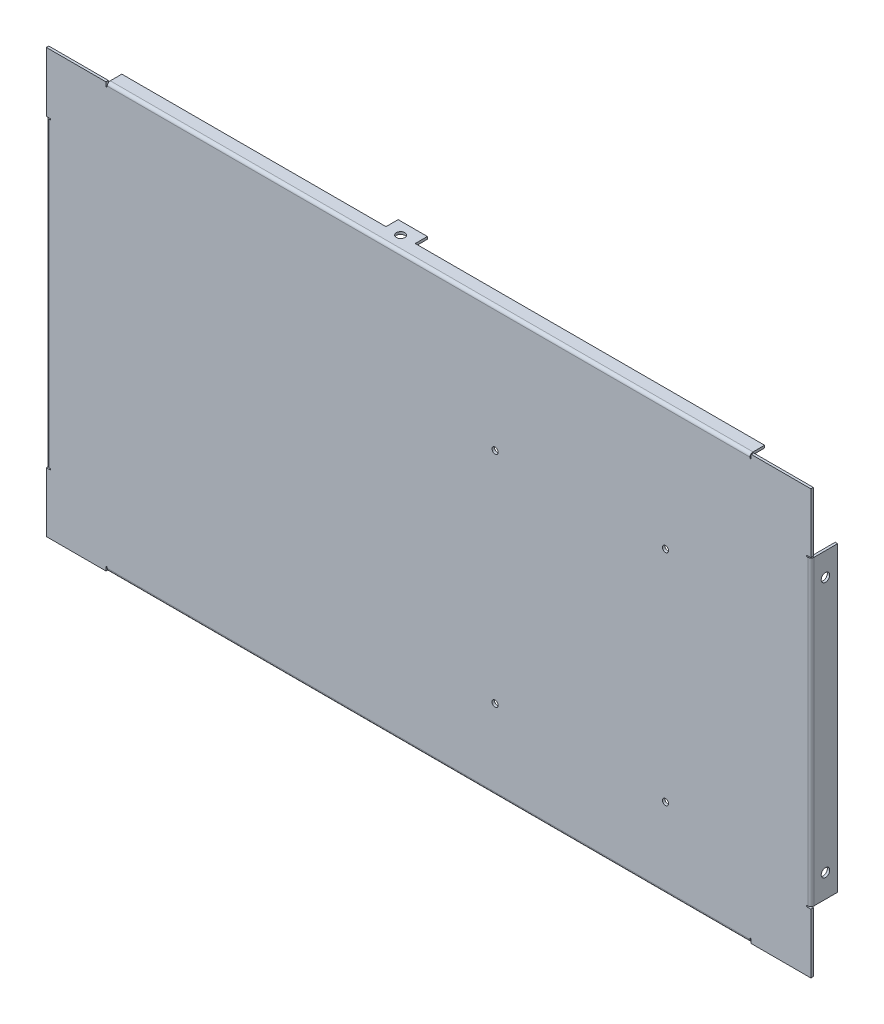
from build123d import *

# Parameters (mm, degrees)
SKETCH_1_W                        = 628
SKETCH_1_H                        = 348
SM_BASE_FLANGE_1_DEPTH            = 2
SM_EDGE_FLANGE_1_STRIP_W          = 9
SM_EDGE_FLANGE_1_STRIP_H          = 2
SM_EDGE_FLANGE_1_STRIP_CUT_DEPTH  = 248
SM_EDGE_FLANGE_1_RELIEF_W         = 10
SM_EDGE_FLANGE_1_RELIEF_H         = 1
SM_EDGE_FLANGE_1_RELIEF_CUT_DEPTH = 2
SM_EDGE_FLANGE_1_DEPTH            = 248
SM_EDGE_FLANGE_2_STRIP_W          = 9
SM_EDGE_FLANGE_2_STRIP_H          = 2
SM_EDGE_FLANGE_2_STRIP_CUT_DEPTH  = 528
SM_EDGE_FLANGE_2_RELIEF_W         = 10
SM_EDGE_FLANGE_2_RELIEF_H         = 1
SM_EDGE_FLANGE_2_RELIEF_CUT_DEPTH = 2
SM_EDGE_FLANGE_2_DEPTH            = 528
SM_EDGE_FLANGE_2_FLAT_DEPTH       = 2
SM_EDGE_FLANGE_3_STRIP_W          = 9
SM_EDGE_FLANGE_3_STRIP_H          = 2
SM_EDGE_FLANGE_3_STRIP_CUT_DEPTH  = 248
SM_EDGE_FLANGE_3_RELIEF_W         = 10
SM_EDGE_FLANGE_3_RELIEF_H         = 1
SM_EDGE_FLANGE_3_RELIEF_CUT_DEPTH = 2
SM_EDGE_FLANGE_3_DEPTH            = 248
SM_EDGE_FLANGE_4_STRIP_W          = 9
SM_EDGE_FLANGE_4_STRIP_H          = 2
SM_EDGE_FLANGE_4_STRIP_CUT_DEPTH  = 528
SM_EDGE_FLANGE_4_RELIEF_W         = 10
SM_EDGE_FLANGE_4_RELIEF_H         = 1
SM_EDGE_FLANGE_4_RELIEF_CUT_DEPTH = 2
SM_EDGE_FLANGE_4_DEPTH            = 528
SKETCH_15_R                       = 3.5
CUT_EXTRUDE_1_DEPTH               = 653.030674125
CUT_EXTRUDE_2_REACH               = 469.756
SKETCH_16_R                       = 3.5
HOLE_WIZARD_M6_1_D                = 5
HOLE_WIZARD_M6_1_DEPTH            = 15
HOLE_WIZARD_M6_1_TIP              = 1.502151548
CUT_EXTRUDE_3_REACH               = 471.238
SKETCH_20_R                       = 3.5


# Sheet-metal steps are written as plain solids
with BuildPart() as part:
    # Sketch 1 → 基体-法兰1 (new body)
    with BuildSketch(Plane.XY):
        Rectangle(SKETCH_1_W, SKETCH_1_H)
    extrude(amount=-SM_BASE_FLANGE_1_DEPTH)

    # 边线-法兰1 strip (across the edge) → 边线-法兰1 strip cut (cut)
    with BuildSketch(Plane(origin=(314, 124, -2), x_dir=(-1, 0, 0), z_dir=(0, -1, 0))):
        with Locations((-2, -1)):
            Rectangle(SM_EDGE_FLANGE_1_STRIP_W, SM_EDGE_FLANGE_1_STRIP_H)
    extrude(amount=SM_EDGE_FLANGE_1_STRIP_CUT_DEPTH, mode=Mode.SUBTRACT)

    # 边线-法兰1 relief (on the sheet) → 边线-法兰1 relief cut (cut)
    with BuildSketch(Plane(origin=(311.5, 124, -2), x_dir=(-1, 0, 0), z_dir=(0, 0, -1))):
        with Locations((-4, 0.5)):
            Rectangle(SM_EDGE_FLANGE_1_RELIEF_W, SM_EDGE_FLANGE_1_RELIEF_H)
        with Locations((-4, -248.5)):
            Rectangle(SM_EDGE_FLANGE_1_RELIEF_W, SM_EDGE_FLANGE_1_RELIEF_H)
    extrude(amount=-SM_EDGE_FLANGE_1_RELIEF_CUT_DEPTH, mode=Mode.SUBTRACT)

    # 边线-法兰1 section (across the edge) → 边线-法兰1 (add)
    with BuildSketch(Plane(origin=(314, 124, -2), x_dir=(-1, 0, 0), z_dir=(0, -1, 0))):
        with BuildLine():
            Line((0, 0.5), (0, 20))
            Line((0, 20), (2, 20))
            Line((2, 20), (2, 0.5))
            ThreePointArc((2, 0.5), (2.146446609, 0.146446609), (2.5, 0))
            Line((2.5, 0), (2.5, -2))
            ThreePointArc((2.5, -2), (0.732233047, -1.267766953), (0, 0.5))
        make_face()
    extrude(amount=SM_EDGE_FLANGE_1_DEPTH)

    # 边线-法兰2 strip (across the edge) → 边线-法兰2 strip cut (cut)
    with BuildSketch(Plane(origin=(-264, 174, -2), x_dir=(0, -1, 0), z_dir=(1, 0, 0))):
        with Locations((-2, -1)):
            Rectangle(SM_EDGE_FLANGE_2_STRIP_W, SM_EDGE_FLANGE_2_STRIP_H)
    extrude(amount=SM_EDGE_FLANGE_2_STRIP_CUT_DEPTH, mode=Mode.SUBTRACT)

    # 边线-法兰2 relief (on the sheet) → 边线-法兰2 relief cut (cut)
    with BuildSketch(Plane(origin=(-264, 171.5, -2), x_dir=(0, -1, 0), z_dir=(0, 0, -1))):
        with Locations((-4, 0.5)):
            Rectangle(SM_EDGE_FLANGE_2_RELIEF_W, SM_EDGE_FLANGE_2_RELIEF_H)
        with Locations((-4, -528.5)):
            Rectangle(SM_EDGE_FLANGE_2_RELIEF_W, SM_EDGE_FLANGE_2_RELIEF_H)
    extrude(amount=-SM_EDGE_FLANGE_2_RELIEF_CUT_DEPTH, mode=Mode.SUBTRACT)

    # 边线-法兰2 bend section (across the edge) → 边线-法兰2 (add)
    with BuildSketch(Plane(origin=(-264, 174, -2), x_dir=(0, -1, 0), z_dir=(1, 0, 0))):
        with BuildLine():
            Line((0, 0.5), (2, 0.5))
            ThreePointArc((2, 0.5), (2.146446609, 0.146446609), (2.5, 0))
            Line((2.5, 0), (2.5, -2))
            ThreePointArc((2.5, -2), (0.732233047, -1.267766953), (0, 0.5))
        make_face()
    extrude(amount=SM_EDGE_FLANGE_2_DEPTH)

    # 边线-法兰2 profile (on flange) → 边线-法兰2 flat (add)
    with BuildSketch(Plane(origin=(0, 174, -2), x_dir=(1, 0, 0), z_dir=(0, 1, 0))):
        Polygon((264, 0.5), (264, 10), (-23, 10), (-23, 20), (-47, 20), (-47, 10), (-264, 10), (-264, 0.5), align=None)
    extrude(amount=-SM_EDGE_FLANGE_2_FLAT_DEPTH)

    # 边线-法兰3 strip (across the edge) → 边线-法兰3 strip cut (cut)
    with BuildSketch(Plane(origin=(-314, -124, -2), x_dir=(1, 0, 0), z_dir=(0, 1, 0))):
        with Locations((-2, -1)):
            Rectangle(SM_EDGE_FLANGE_3_STRIP_W, SM_EDGE_FLANGE_3_STRIP_H)
    extrude(amount=SM_EDGE_FLANGE_3_STRIP_CUT_DEPTH, mode=Mode.SUBTRACT)

    # 边线-法兰3 relief (on the sheet) → 边线-法兰3 relief cut (cut)
    with BuildSketch(Plane(origin=(-311.5, -124, -2), x_dir=(1, 0, 0), z_dir=(0, 0, -1))):
        with Locations((-4, 0.5)):
            Rectangle(SM_EDGE_FLANGE_3_RELIEF_W, SM_EDGE_FLANGE_3_RELIEF_H)
        with Locations((-4, -248.5)):
            Rectangle(SM_EDGE_FLANGE_3_RELIEF_W, SM_EDGE_FLANGE_3_RELIEF_H)
    extrude(amount=-SM_EDGE_FLANGE_3_RELIEF_CUT_DEPTH, mode=Mode.SUBTRACT)

    # 边线-法兰3 section (across the edge) → 边线-法兰3 (add)
    with BuildSketch(Plane(origin=(-314, -124, -2), x_dir=(1, 0, 0), z_dir=(0, 1, 0))):
        with BuildLine():
            Line((0, 0.5), (0, 20))
            Line((0, 20), (2, 20))
            Line((2, 20), (2, 0.5))
            ThreePointArc((2, 0.5), (2.146446609, 0.146446609), (2.5, 0))
            Line((2.5, 0), (2.5, -2))
            ThreePointArc((2.5, -2), (0.732233047, -1.267766953), (0, 0.5))
        make_face()
    extrude(amount=SM_EDGE_FLANGE_3_DEPTH)

    # 边线-法兰4 strip (across the edge) → 边线-法兰4 strip cut (cut)
    with BuildSketch(Plane(origin=(264, -174, -2), x_dir=(0, 1, 0), z_dir=(-1, 0, 0))):
        with Locations((-2, -1)):
            Rectangle(SM_EDGE_FLANGE_4_STRIP_W, SM_EDGE_FLANGE_4_STRIP_H)
    extrude(amount=SM_EDGE_FLANGE_4_STRIP_CUT_DEPTH, mode=Mode.SUBTRACT)

    # 边线-法兰4 relief (on the sheet) → 边线-法兰4 relief cut (cut)
    with BuildSketch(Plane(origin=(264, -171.5, -2), x_dir=(0, 1, 0), z_dir=(0, 0, -1))):
        with Locations((-4, 0.5)):
            Rectangle(SM_EDGE_FLANGE_4_RELIEF_W, SM_EDGE_FLANGE_4_RELIEF_H)
        with Locations((-4, -528.5)):
            Rectangle(SM_EDGE_FLANGE_4_RELIEF_W, SM_EDGE_FLANGE_4_RELIEF_H)
    extrude(amount=-SM_EDGE_FLANGE_4_RELIEF_CUT_DEPTH, mode=Mode.SUBTRACT)

    # 边线-法兰4 section (across the edge) → 边线-法兰4 (add)
    with BuildSketch(Plane(origin=(264, -174, -2), x_dir=(0, 1, 0), z_dir=(-1, 0, 0))):
        with BuildLine():
            Line((0, 0.5), (0, 20))
            Line((0, 20), (2, 20))
            Line((2, 20), (2, 0.5))
            ThreePointArc((2, 0.5), (2.146446609, 0.146446609), (2.5, 0))
            Line((2.5, 0), (2.5, -2))
            ThreePointArc((2.5, -2), (0.732233047, -1.267766953), (0, 0.5))
        make_face()
    extrude(amount=SM_EDGE_FLANGE_4_DEPTH)

    # 草图15 → 切除-拉伸1 (cut, through all)
    with BuildSketch(Plane(origin=(314, 0, 0), x_dir=(0, 0, -1), z_dir=(1, 0, 0))):
        with Locations((12, -105)):
            Circle(SKETCH_15_R)
        with Locations((12, 105)):
            Circle(SKETCH_15_R)
    extrude(amount=-CUT_EXTRUDE_1_DEPTH, mode=Mode.SUBTRACT)

    # 草图16 → 切除-拉伸2 (cut, up to next)
    with BuildSketch(Plane.XZ.offset(-172), mode=Mode.PRIVATE) as cut_extrude_2_sk1:
        with Locations(Location((-35, -12, 0), (0, 0, 270))):
            Circle(SKETCH_16_R)
    cut_extrude_2_tool1 = extrude(cut_extrude_2_sk1.sketch, amount=-CUT_EXTRUDE_2_REACH, mode=Mode.PRIVATE) & part.part
    add(cut_extrude_2_tool1.solids().sort_by_distance((-35, 172, -12))[0], mode=Mode.SUBTRACT)

    # M6 螺纹孔1
    with Locations(Plane(origin=(0, 0, -2), x_dir=(-1, 0, 0), z_dir=(0, 0, -1))):
        with Locations((-194.6, 71.5), (-54.6, 71.5), (-54.6, -108.5), (-194.6, -108.5)):
            Hole(HOLE_WIZARD_M6_1_D / 2, depth=HOLE_WIZARD_M6_1_DEPTH)
            with Locations((0, 0, -(HOLE_WIZARD_M6_1_DEPTH + HOLE_WIZARD_M6_1_TIP / 2))):  # 118° drill point
                Cone(0, HOLE_WIZARD_M6_1_D / 2, HOLE_WIZARD_M6_1_TIP, mode=Mode.SUBTRACT)

    # 草图20 → 切除-拉伸3 (cut, up to next)
    with BuildSketch(Plane.XZ.offset(174), mode=Mode.PRIVATE) as cut_extrude_3_sk1:
        with Locations(Location((0, -12, 0), (0, 0, 270))):
            Circle(SKETCH_20_R)
    cut_extrude_3_tool1 = extrude(cut_extrude_3_sk1.sketch, amount=-CUT_EXTRUDE_3_REACH, mode=Mode.PRIVATE) & part.part
    # 草图20 → 切除-拉伸3 (cut, up to next)
    with BuildSketch(Plane.XZ.offset(174), mode=Mode.PRIVATE) as cut_extrude_3_sk2:
        with Locations(Location((-250, -12, 0), (0, 0, 270))):
            Circle(SKETCH_20_R)
    cut_extrude_3_tool2 = extrude(cut_extrude_3_sk2.sketch, amount=-CUT_EXTRUDE_3_REACH, mode=Mode.PRIVATE) & part.part
    # 草图20 → 切除-拉伸3 (cut, up to next)
    with BuildSketch(Plane.XZ.offset(174), mode=Mode.PRIVATE) as cut_extrude_3_sk3:
        with Locations(Location((250, -12, 0), (0, 0, 270))):
            Circle(SKETCH_20_R)
    cut_extrude_3_tool3 = extrude(cut_extrude_3_sk3.sketch, amount=-CUT_EXTRUDE_3_REACH, mode=Mode.PRIVATE) & part.part
    add(cut_extrude_3_tool1.solids().sort_by_distance((0, -174, -12))[0], mode=Mode.SUBTRACT)
    add(cut_extrude_3_tool2.solids().sort_by_distance((-250, -174, -12))[0], mode=Mode.SUBTRACT)
    add(cut_extrude_3_tool3.solids().sort_by_distance((250, -174, -12))[0], mode=Mode.SUBTRACT)


solid = part.part
